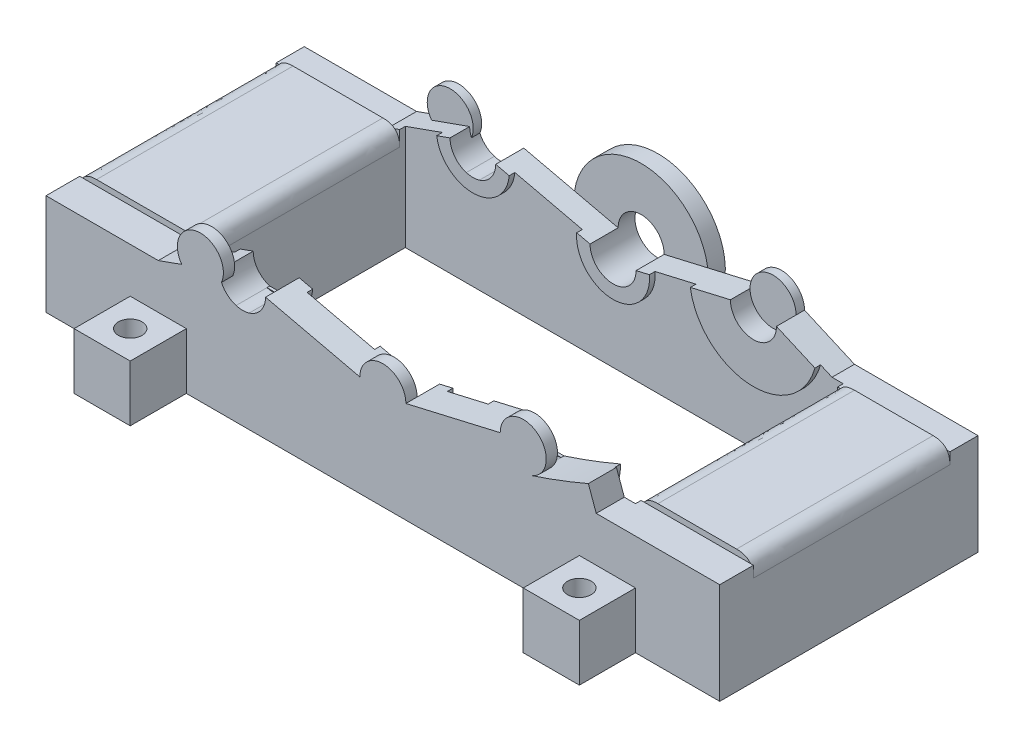
from build123d import *

# Parameters (mm, degrees)
SKETCH_1_5_W             = 10
SKETCH_1_5_H             = 10
SKETCH_1_5_R             = 2.1
EXTRUDE_4_DEPTH          = 10
EXTRUDE_4_2_DEPTH        = 10
SKETCH_1_6_W             = 10
SKETCH_1_6_H             = 10
SKETCH_1_6_R             = 2.1
EXTRUDE_5_DEPTH          = 35
SKETCH_1_W               = 20
SKETCH_1_H               = 35
EXTRUDE_7_DEPTH          = 19
SKETCH_1_W_2             = 22
EXTRUDE_7_2_DEPTH        = 19
FILLET_8_SIZE            = 3
FILLET_9_SIZE            = 3
EXTRUDE_8_DEPTH          = 18
SKETCH_2_W               = 37
SKETCH_2_H               = 30
CUT_EXTRUDE_2_DEPTH      = 138.800580637
CUT_EXTRUDE_3_DEPTH      = 113.111551644
CUT_EXTRUDE_3_DEPTH_BACK = 113.111551644
CUT_EXTRUDE_4_DEPTH      = 6
CUT_EXTRUDE_START        = -5.5
CUT_EXTRUDE_5_DEPTH      = 5.5
EXTRUDE_START            = 24
EXTRUDE_14_DEPTH         = 6
EXTRUDE_15_DEPTH         = 5
CUT_EXTRUDE_6_DEPTH      = 138.800580637
CUT_EXTRUDE_6_DEPTH_BACK = 138.800580637
EXTRUDE_START_2          = -2
SKETCH_10_R              = 4.1
EXTRUDE_17_DEPTH         = 2
SKETCH_11_R              = 4.1
EXTRUDE_18_DEPTH         = 1.5
EXTRUDE_19_DEPTH         = 6
CUT_EXTRUDE_7_DEPTH      = 36
CUT_EXTRUDE_7_DEPTH_BACK = 1
EXTRUDE_START_3          = 3
SKETCH_13_R              = 12
SKETCH_13_R_2            = 4.1
EXTRUDE_20_DEPTH         = 3
CUT_EXTRUDE_9_DEPTH      = 40


with BuildPart() as part:
    # Эскиз1<5> → Бобышка-Вытянуть4 (new body)
    with BuildSketch(Plane(origin=(0, 0, 0), x_dir=(1, 0, 0), z_dir=(0, 1, 0))):
        with Locations((-40, -35)):
            Rectangle(SKETCH_1_5_W, SKETCH_1_5_H)
        with Locations(Location((-40, -35, 0), (0, 0, 270))):
            Circle(SKETCH_1_5_R, mode=Mode.SUBTRACT)
    extrude(amount=EXTRUDE_4_DEPTH)



with BuildPart() as body_2:
    # Эскиз1<5> → Extrude 4 2 (new body)
    with BuildSketch(Plane(origin=(0, 0, 0), x_dir=(1, 0, 0), z_dir=(0, 1, 0))):
        with Locations((40, -35)):
            Rectangle(SKETCH_1_5_W, SKETCH_1_5_H)
        with Locations(Location((40, -35, 0), (0, 0, 270))):
            Circle(SKETCH_1_5_R, mode=Mode.SUBTRACT)
    extrude(amount=EXTRUDE_4_2_DEPTH)


with BuildPart() as body_3:
    # Эскиз1<6> → Бобышка-Вытянуть5 (new body)
    # profile 1 of 3: a face of its own
    with BuildSketch(Plane(origin=(0, 0, 0), x_dir=(1, 0, 0), z_dir=(0, 1, 0))):
        Polygon((45, 48), (35, 48), (-35, 48), (-45, 48), (-60, 48), (-60, 43), (-60, 16), (-55, 16), (-55, 43), (55, 43), (55, 16), (60, 16), (60, 43), (60, 48), align=None)
    # profile 2 of 3: a face of its own
    with BuildSketch(Plane(origin=(0, 0, 0), x_dir=(1, 0, 0), z_dir=(0, 1, 0))):
        with Locations((-40, 53)):
            Rectangle(SKETCH_1_6_W, SKETCH_1_6_H)
        with Locations(Location((-40, 53, 0), (0, 0, 270))):
            Circle(SKETCH_1_6_R, mode=Mode.SUBTRACT)
    # profile 3 of 3: a face of its own
    with BuildSketch(Plane(origin=(0, 0, 0), x_dir=(1, 0, 0), z_dir=(0, 1, 0))):
        with Locations((40, 53)):
            Rectangle(SKETCH_1_6_W, SKETCH_1_6_H)
        with Locations(Location((40, 53, 0), (0, 0, 270))):
            Circle(SKETCH_1_6_R, mode=Mode.SUBTRACT)
    extrude(amount=EXTRUDE_5_DEPTH)


with BuildPart() as body_4:
    # Эскиз1 → Бобышка-Вытянуть7 (new body)
    with BuildSketch(Plane(origin=(0, 0, 0), x_dir=(1, 0, 0), z_dir=(0, 1, 0))):
        with Locations((50, -6.5)):
            Rectangle(SKETCH_1_W, SKETCH_1_H)
    extrude(amount=EXTRUDE_7_DEPTH)

    # Скругление9
    # a fillet whose section is not a circle: 3 mm, written as the material it takes off along each edge
    with BuildSketch(Plane(origin=(40, 19, 31.5), x_dir=(0, -1, 0), z_dir=(0, 0, -1)), Plane(origin=(60, 19, -18.5), x_dir=(0, -1, 0), z_dir=(0, 0, 1))) as fillet_9_piece_1:
        with BuildLine():
            Bezier((FILLET_9_SIZE, 0), (0, 0), (0, -FILLET_9_SIZE), weights=[1, 1, 1])
            Line((0, -FILLET_9_SIZE), (0, 0))
            Line((0, 0), (FILLET_9_SIZE, 0))
        make_face()
    extrude(amount=50, mode=Mode.SUBTRACT)


with BuildPart() as body_5:
    # Эскиз1 → Extrude 7 2 (new body)
    with BuildSketch(Plane(origin=(0, 0, 0), x_dir=(1, 0, 0), z_dir=(0, 1, 0))):
        with Locations((-49, -6.5)):
            Rectangle(SKETCH_1_W_2, SKETCH_1_H)
    extrude(amount=EXTRUDE_7_2_DEPTH)

    # Скругление8
    # a fillet whose section is not a circle: 3 mm, written as the material it takes off along each edge
    with BuildSketch(Plane(origin=(-60, 19, -18.5), x_dir=(0, -1, 0), z_dir=(0, 0, 1)), Plane(origin=(-38, 19, 31.5), x_dir=(0, -1, 0), z_dir=(0, 0, -1))) as fillet_8_piece_1:
        with BuildLine():
            Bezier((FILLET_8_SIZE, 0), (0, 0), (0, FILLET_8_SIZE), weights=[1, 1, 1])
            Line((0, FILLET_8_SIZE), (0, 0))
            Line((0, 0), (FILLET_8_SIZE, 0))
        make_face()
    extrude(amount=50, mode=Mode.SUBTRACT)


with BuildPart() as part_1:
    add(part.part)

    add(body_2.part)  # Бобышка-Вытянуть8 merges body 2

    add(body_3.part)  # Бобышка-Вытянуть8 merges body 3

    add(body_4.part)  # Бобышка-Вытянуть8 merges body 4

    add(body_5.part)  # Бобышка-Вытянуть8 merges body 5
    # Эскиз1<9> → Бобышка-Вытянуть8 (add)
    with BuildSketch(Plane(origin=(0, 0, 0), x_dir=(1, 0, 0), z_dir=(0, 1, 0))):
        Polygon((-38, 11), (40, 11), (60, 11), (60, 16), (55, 16), (-55, 16), (-60, 16), (-60, 11), align=None)
        Polygon((40, -24), (60, -24), (60, -30), (45, -30), (35, -30), (-35, -30), (-45, -30), (-60, -30), (-60, -24), (-38, -24), align=None)
    extrude(amount=EXTRUDE_8_DEPTH)

    # Эскиз2 → Вырез-Вытянуть2 (cut, through all)
    with BuildSketch(Plane.ZY.offset(60)):
        with Locations((-39.5, 15)):
            Rectangle(SKETCH_2_W, SKETCH_2_H)
    extrude(amount=-CUT_EXTRUDE_2_DEPTH, mode=Mode.SUBTRACT)

    # Эскиз3 → Вырез-Вытянуть3 (cut, two sides: drawn at the far end of the back side and taken through both)
    with BuildSketch(Plane.XY.offset(30).offset(-CUT_EXTRUDE_3_DEPTH_BACK)):
        with BuildLine():
            Line((-4.1, 18), (4.1, 18))
            ThreePointArc((4.1, 18), (0, 13.9), (-4.1, 18))
        make_face()
    extrude(amount=CUT_EXTRUDE_3_DEPTH + CUT_EXTRUDE_3_DEPTH_BACK, mode=Mode.SUBTRACT)

    # Эскиз6 → Вырез-Вытянуть4 (cut)
    with BuildSketch(Plane(origin=(0, 0, -16), x_dir=(-1, 0, 0), z_dir=(0, 0, -1))):
        with BuildLine():
            Line((-26.264911064, 18), (-23.735088936, 18))
            ThreePointArc((-23.735088936, 18), (-25, 17.8), (-26.264911064, 18))
        make_face()
        with BuildLine():
            Line((23.803098267, 18), (26.13923016, 18))
            ThreePointArc((26.13923016, 18), (24.971164214, 17.830091849), (23.803098267, 18))
        make_face()
    extrude(amount=-CUT_EXTRUDE_4_DEPTH, mode=Mode.SUBTRACT)

    # Эскиз7 → Вырез-Вытянуть5 (cut)
    with BuildSketch(Plane.XY.offset(30).offset(CUT_EXTRUDE_START)):
        with BuildLine():
            Line((-26.13923016, 18), (-23.803098267, 18))
            ThreePointArc((-23.803098267, 18), (-24.971164214, 17.830091849), (-26.13923016, 18))
        make_face()
        with BuildLine():
            Line((23.735088936, 18), (26.264911064, 18))
            ThreePointArc((26.264911064, 18), (25, 17.8), (23.735088936, 18))
        make_face()
    extrude(amount=CUT_EXTRUDE_5_DEPTH, mode=Mode.SUBTRACT)

    # Бобышка-Вытянуть14: read off the stored shape, not the designer's step
    # Бобышка-Вытянуть14 outline → Бобышка-Вытянуть14 (add)
    with BuildSketch(Plane.XY.offset(EXTRUDE_START)):
        with BuildLine():
            ThreePointArc((23.735088935, 18), (21.68366653, 19.489205044), (20.9, 21.9))
            Line((20.9, 21.9), (4.1, 18))
            Line((4.1, 18), (23.735088935, 18))
        make_face()
        with BuildLine():
            ThreePointArc((-20.9, 21.9), (-21.711099928, 19.473259749), (-23.803098267, 18))
            Line((-23.803098267, 18), (-4.1, 18))
            Line((-4.1, 18), (-20.9, 21.9))
        make_face()
        with BuildLine():
            ThreePointArc((-26.13923016, 18), (-28.265749222, 19.45947321), (-29.1, 21.9))
            Line((-29.1, 21.9), (-40, 18))
            Line((-40, 18), (-26.13923016, 18))
        make_face()
    extrude(amount=EXTRUDE_14_DEPTH)

    # Эскиз6<6> → Бобышка-Вытянуть15 (add)
    with BuildSketch(Plane(origin=(0, 0, -16), x_dir=(-1, 0, 0), z_dir=(0, 0, -1))):
        with BuildLine():
            ThreePointArc((-23.735088936, 18), (-21.68366653, 19.489205044), (-20.9, 21.9))
            Line((-20.9, 21.9), (-4.1, 18))
            Line((-4.1, 18), (-23.735088936, 18))
        make_face()
        with BuildLine():
            ThreePointArc((20.9, 21.9), (21.711099928, 19.473259749), (23.803098267, 18))
            Line((23.803098267, 18), (4.1, 18))
            Line((4.1, 18), (20.9, 21.9))
        make_face()
        with BuildLine():
            Line((29.042328427, 21.9), (40, 18))
            Line((40, 18), (26.13923016, 18))
            ThreePointArc((26.13923016, 18), (28.2312285, 19.473259749), (29.042328427, 21.9))
        make_face()
        with BuildLine():
            Line((-38, 18), (-26.264911064, 18))
            ThreePointArc((-26.264911064, 18), (-28.31633347, 19.489205044), (-29.1, 21.9))
            Line((-29.1, 21.9), (-38, 18))
        make_face()
    extrude(amount=-EXTRUDE_15_DEPTH)

    # Эскиз9 → Вырез-Вытянуть6 (cut, two sides: drawn at the far end of the back side and taken through both)
    with BuildSketch(Plane.ZY.offset(60).offset(-CUT_EXTRUDE_6_DEPTH_BACK)):
        Polygon((-58, 34.891965128), (-58, 35), (-16, 35), (-16, 34.9), align=None)
    extrude(amount=CUT_EXTRUDE_6_DEPTH + CUT_EXTRUDE_6_DEPTH_BACK, mode=Mode.SUBTRACT)

    # Эскиз10 → Бобышка-Вытянуть17 (add)
    with BuildSketch(Plane.XY.offset(30).offset(EXTRUDE_START_2)):
        with Locations((25, 21.9)):
            Circle(SKETCH_10_R)
        with Locations((0, 18)):
            Circle(SKETCH_10_R)
        with Locations((-32.5, 21.9)):
            Circle(SKETCH_10_R)
    extrude(amount=EXTRUDE_17_DEPTH)

    # Эскиз11 → Бобышка-Вытянуть18 (add)
    with BuildSketch(Plane(origin=(0, 0, -16), x_dir=(-1, 0, 0), z_dir=(0, 0, -1))):
        with Locations((-25, 21.9)):
            Circle(SKETCH_11_R)
        with Locations((32.5, 21.9)):
            Circle(SKETCH_11_R)
    extrude(amount=-EXTRUDE_18_DEPTH)

    # Бобышка-Вытянуть19: read off the stored shape, not the designer's step
    # Бобышка-Вытянуть19 outline → Бобышка-Вытянуть19 (add)
    with BuildSketch(Plane.XY.offset(EXTRUDE_START)):
        with BuildLine():
            Line((26.264911064, 18), (38, 18))
            Line((38, 18), (36.6, 21.9))
            ThreePointArc((36.6, 21.9), (31.478486585, 19.828016661), (26.264911064, 18))
        make_face()
    extrude(amount=EXTRUDE_19_DEPTH)

    # Эскиз12 → Вырез-Вытянуть7 (cut, two sides: drawn at the far end of the back side and taken through both)
    with BuildSketch(Plane(origin=(0, 0, 24), x_dir=(-1, 0, 0), z_dir=(0, 0, -1)).offset(-CUT_EXTRUDE_7_DEPTH_BACK)):
        with BuildLine():
            Line((-40, 0), (-40, 18))
            Line((-40, 18), (-38, 18))
            Line((-38, 18), (-36.331975313, 22.6466402))
            ThreePointArc((-36.331975313, 22.6466402), (-26.202477843, 10.607295137), (-13.76489452, 20.243636228))
            Line((-13.76489452, 20.243636228), (-6.476544564, 18.551697845))
            ThreePointArc((-6.476544564, 18.551697845), (0, 11.5), (6.476544564, 18.551697845))
            Line((6.476544564, 18.551697845), (18.497791598, 21.342344478))
            ThreePointArc((18.497791598, 21.342344478), (24.835126866, 15.431515556), (31.414269621, 21.071958576))
            Line((31.414269621, 21.071958576), (38, 18.71559633))
            Line((38, 18.71559633), (38, 0))
            Line((38, 0), (-40, 0))
        make_face()
    extrude(amount=CUT_EXTRUDE_7_DEPTH + CUT_EXTRUDE_7_DEPTH_BACK, mode=Mode.SUBTRACT)

    # Эскиз13 → Бобышка-Вытянуть20 (add)
    with BuildSketch(Plane(origin=(0, 0, -16), x_dir=(-1, 0, 0), z_dir=(0, 0, -1)).offset(EXTRUDE_START_3)):
        with Locations(Location((0, 18, 0), (0, 0, 171.361826288))):
            Circle(SKETCH_13_R)
        with Locations((0, 18)):
            Circle(SKETCH_13_R_2, mode=Mode.SUBTRACT)
    extrude(amount=-EXTRUDE_20_DEPTH)

    # Эскиз14 → Вырез-Вытянуть9 (cut)
    with BuildSketch(Plane(origin=(0, 0, 0), x_dir=(-1, 0, 0), z_dir=(0, -1, 0))):
        Polygon((-55, 16), (-55, 43), (55, 43), (55, 16), (60, 16), (60, 63), (-60, 63), (-60, 16), align=None)
    extrude(amount=-CUT_EXTRUDE_9_DEPTH, mode=Mode.SUBTRACT)


solid = part_1.part
